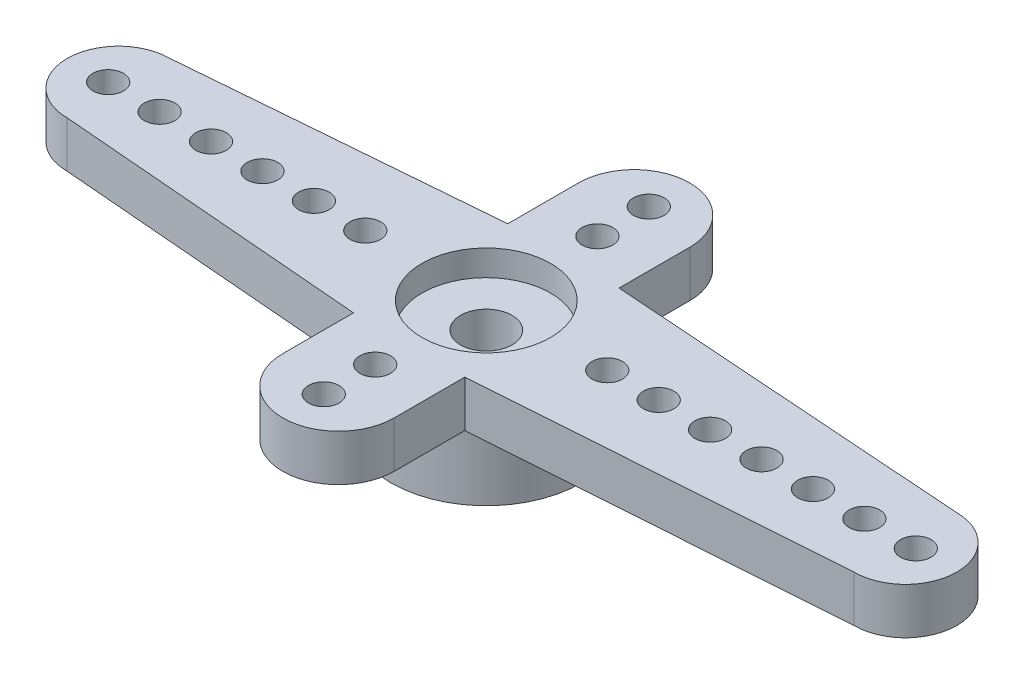
from build123d import *

# Parameters (mm, degrees)
CROQUIS1_R              = 3.7
SALIENTE_EXTRUIR2_DEPTH = 4.3
CROQUIS2_R              = 2.5
CORTAR_EXTRUIR1_DEPTH   = 1.5
CORTAR_EXTRUIR2_START   = -1
CROQUIS3_R              = 2.5
CORTAR_EXTRUIR2_DEPTH   = 1
CROQUIS4_R              = 1
CORTAR_EXTRUIR3_DEPTH   = 1.8
SALIENTE_EXTRUIR3_DEPTH = 1.8
CROQUIS6_R              = 0.595
CORTAR_EXTRUIR4_DEPTH   = 1.8
CROQUIS7_R              = 0.595
SALIENTE_EXTRUIR4_DEPTH = 1.8


with BuildPart() as part:
    # Croquis1 → Saliente-Extruir2 (new body)
    with BuildSketch(Plane(origin=(0, 0, 0), x_dir=(1, 0, 0), z_dir=(0, 1, 0))):
        Circle(CROQUIS1_R)
    extrude(amount=SALIENTE_EXTRUIR2_DEPTH)

    # Croquis2 → Cortar-Extruir1 (cut)
    with BuildSketch(Plane.XZ):
        Circle(CROQUIS2_R)
    extrude(amount=-CORTAR_EXTRUIR1_DEPTH, mode=Mode.SUBTRACT)

    # Croquis3 → Cortar-Extruir2 (cut)
    with BuildSketch(Plane(origin=(0, 4.3, 0), x_dir=(1, 0, 0), z_dir=(0, 1, 0)).offset(CORTAR_EXTRUIR2_START)):
        Circle(CROQUIS3_R)
    extrude(amount=CORTAR_EXTRUIR2_DEPTH, mode=Mode.SUBTRACT)

    # Croquis4 → Cortar-Extruir3 (cut)
    with BuildSketch(Plane(origin=(0, 3.3, 0), x_dir=(1, 0, 0), z_dir=(0, 1, 0))):
        Circle(CROQUIS4_R)
    extrude(amount=-CORTAR_EXTRUIR3_DEPTH, mode=Mode.SUBTRACT)

    # Croquis5 → Saliente-Extruir3 (add)
    with BuildSketch(Plane(origin=(0, 4.3, 0), x_dir=(1, 0, 0), z_dir=(0, 1, 0))):
        with BuildLine():
            Line((-2.16564, 3.000000565), (-3.120237459, 0))
            Line((-3.120237459, 0), (-2.16564, -3.000000565))
            Line((-2.16564, -3.000000565), (-14.3, -2))
            ThreePointArc((-14.3, -2), (-16.3, 0), (-14.3, 2))
            Line((-14.3, 2), (-2.16564, 3.000000565))
        make_face()
        with BuildLine():
            Line((3.120237459, 0), (2.16564, -3.000000565))
            Line((2.16564, -3.000000565), (16.3, -2))
            ThreePointArc((16.3, -2), (18.3, 0), (16.3, 2))
            Line((16.3, 2), (2.16564, 3.000000565))
            Line((2.16564, 3.000000565), (3.120237459, 0))
        make_face()
    extrude(amount=-SALIENTE_EXTRUIR3_DEPTH)

    # Croquis6 → Cortar-Extruir4 (cut)
    with BuildSketch(Plane(origin=(0, 4.3, 0), x_dir=(1, 0, 0), z_dir=(0, 1, 0))):
        with Locations((-14.705, 0)):
            Circle(CROQUIS6_R)
        with Locations((-12.705, 0)):
            Circle(CROQUIS6_R)
        with Locations((-10.705, 0)):
            Circle(CROQUIS6_R)
        with Locations((-8.705, 0)):
            Circle(CROQUIS6_R)
        with Locations((-6.705, 0)):
            Circle(CROQUIS6_R)
        with Locations((-4.705, 0)):
            Circle(CROQUIS6_R)
        with Locations((14.705, 0)):
            Circle(CROQUIS6_R)
        with Locations((12.705, 0)):
            Circle(CROQUIS6_R)
        with Locations((10.705, 0)):
            Circle(CROQUIS6_R)
        with Locations((8.705, 0)):
            Circle(CROQUIS6_R)
        with Locations((6.705, 0)):
            Circle(CROQUIS6_R)
        with Locations((4.705, 0)):
            Circle(CROQUIS6_R)
        with Locations((16.705, 0)):
            Circle(CROQUIS6_R)
    extrude(amount=-CORTAR_EXTRUIR4_DEPTH, mode=Mode.SUBTRACT)

    # Croquis7 → Saliente-Extruir4 (add)
    # profile 1 of 2: a face of its own
    with BuildSketch(Plane(origin=(0, 4.3, 0), x_dir=(1, 0, 0), z_dir=(0, 1, 0))):
        with BuildLine():
            Line((-2.16564, 3.000000565), (2.16564, 3.000000565))
            Line((2.16564, 3.000000565), (2.16564, 5.750000565))
            ThreePointArc((2.16564, 5.750000565), (0, 7.915640565), (-2.16564, 5.750000565))
            Line((-2.16564, 5.750000565), (-2.16564, 3.000000565))
        make_face()
        with Locations((0, 6.320640565)):
            Circle(CROQUIS7_R, mode=Mode.SUBTRACT)
        with Locations((0, 4.320640565)):
            Circle(CROQUIS7_R, mode=Mode.SUBTRACT)
    # profile 2 of 2: a face of its own
    with BuildSketch(Plane(origin=(0, 4.3, 0), x_dir=(1, 0, 0), z_dir=(0, 1, 0))):
        with BuildLine():
            Line((2.16564, -3.000000565), (2.16564, -5.750000565))
            ThreePointArc((2.16564, -5.750000565), (0, -7.915640565), (-2.16564, -5.750000565))
            Line((-2.16564, -5.750000565), (-2.16564, -3.000000565))
            Line((-2.16564, -3.000000565), (2.16564, -3.000000565))
        make_face()
        with Locations((0, -4.320640565)):
            Circle(CROQUIS7_R, mode=Mode.SUBTRACT)
        with Locations((0, -6.320640565)):
            Circle(CROQUIS7_R, mode=Mode.SUBTRACT)
    extrude(amount=-SALIENTE_EXTRUIR4_DEPTH)


solid = part.part
